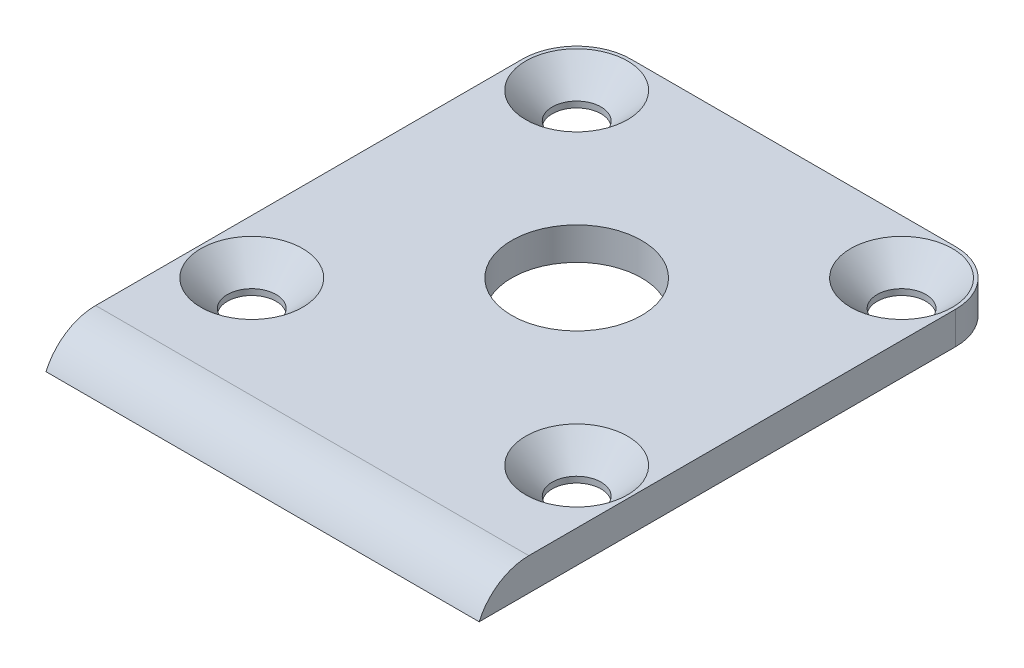
from build123d import *

# Parameters (mm, degrees)
SKETCH1_W                                      = 40
SKETCH1_H                                      = 49
SKETCH1_W_2                                    = 30
SKETCH1_H_2                                    = 30
BOSS_EXTRUDE1_DEPTH                            = 3
FILLET1_R                                      = 5
CSK_FOR_M4_FLAT_HEAD_MACHINE_SCREW2_AT_2_COUNT = 2
CSK_FOR_M4_FLAT_HEAD_MACHINE_SCREW2_AT_2_PITCH = 30
CSK_FOR_M4_FLAT_HEAD_MACHINE_SCREW2_AT_3_COUNT = 2
CSK_FOR_M4_FLAT_HEAD_MACHINE_SCREW2_AT_3_PITCH = 42.426406871
CSK_FOR_M4_FLAT_HEAD_MACHINE_SCREW2_AT_4_COUNT = 2
CSK_FOR_M4_FLAT_HEAD_MACHINE_SCREW2_AT_4_PITCH = 30
SKETCH4_R                                      = 6
CUT_EXTRUDE1_DEPTH                             = 3


with BuildPart() as part:
    # Sketch1 → Boss-Extrude1 (new body)
    # profile 1 of 2: a face of its own
    with BuildSketch(Plane(origin=(0, 0, 0), x_dir=(1, 0, 0), z_dir=(0, 1, 0))):
        with Locations((20, 24.5)):
            Rectangle(SKETCH1_W, SKETCH1_H)
        with Locations((20, 29)):
            Rectangle(SKETCH1_W_2, SKETCH1_H_2, mode=Mode.SUBTRACT)
    # profile 2 of 2: a face of its own
    with BuildSketch(Plane(origin=(0, 0, 0), x_dir=(1, 0, 0), z_dir=(0, 1, 0))):
        with Locations((20, 29)):
            Rectangle(SKETCH1_W_2, SKETCH1_H_2)
    extrude(amount=BOSS_EXTRUDE1_DEPTH)

    # Fillet1
    # the kernel refuses this fillet: 5 mm, written as the material it takes off along each edge
    with BuildSketch(Plane(origin=(-11.456439237, 3, 0), x_dir=(0, -1, 0), z_dir=(1, 0, 0))) as fillet1_piece_1:
        with BuildLine():
            CenterArc((5, 4.582575695), FILLET1_R, 180, 66.421821522)
            Line((0, 4.582575695), (-0.1, 4.582575695))
            Line((-0.1, 4.582575695), (-0.1, 0))
            Line((-0.1, 0), (0, -0.1))
            ThreePointArc((0, -0.1), (1.5, -0.1), (2.96, -0.091651514))
            Line((2.96, -0.091651514), (3, 0))
        make_face()
    extrude(amount=62.912878475, mode=Mode.SUBTRACT)
    with BuildSketch(Plane(origin=(0, -12.5, -49), x_dir=(0, 0, 1), z_dir=(0, 1, 0))) as fillet1_piece_2:
        with BuildLine():
            CenterArc((FILLET1_R, FILLET1_R), FILLET1_R, 180, 90)
            Line((0, FILLET1_R), (-FILLET1_R * 0.02, FILLET1_R))
            Line((-FILLET1_R * 0.02, FILLET1_R), (-FILLET1_R * 0.02, -FILLET1_R * 0.02))
            Line((-FILLET1_R * 0.02, -FILLET1_R * 0.02), (FILLET1_R, -FILLET1_R * 0.02))
            Line((FILLET1_R, -FILLET1_R * 0.02), (FILLET1_R, 0))
        make_face()
    extrude(amount=28, mode=Mode.SUBTRACT)
    with BuildSketch(Plane(origin=(40, -12.5, -49), x_dir=(0, 0, 1), z_dir=(0, 1, 0))) as fillet1_piece_3:
        with BuildLine():
            CenterArc((FILLET1_R, -FILLET1_R), FILLET1_R, 90, 90)
            Line((0, -FILLET1_R), (-FILLET1_R * 0.02, -FILLET1_R))
            Line((-FILLET1_R * 0.02, -FILLET1_R), (-FILLET1_R * 0.02, FILLET1_R * 0.02))
            Line((-FILLET1_R * 0.02, FILLET1_R * 0.02), (FILLET1_R, FILLET1_R * 0.02))
            Line((FILLET1_R, FILLET1_R * 0.02), (FILLET1_R, 0))
        make_face()
    extrude(amount=28, mode=Mode.SUBTRACT)

    # Sketch3 → CSK for M4 Flat Head Machine Screw2 (revolve, cut)
    with BuildSketch(Plane(origin=(5, 3, -44), x_dir=(0, 0, 1), z_dir=(1, 0, 0))):
        Polygon((0, 0), (0, 3), (2.25, 3), (2.25, 2.45), (4.7, 0), align=None)
    csk_for_m4_flat_head_machine_screw2 = revolve(axis=Axis((5, 9.35, -44), (0, -1, 0)), mode=Mode.SUBTRACT)

    # CSK for M4 Flat Head Machine Screw2 at 2: CSK for M4 Flat Head Machine Screw2 ×2
    with Locations(*[(i * CSK_FOR_M4_FLAT_HEAD_MACHINE_SCREW2_AT_2_PITCH, 0, 0) for i in range(1, CSK_FOR_M4_FLAT_HEAD_MACHINE_SCREW2_AT_2_COUNT)]):
        add(csk_for_m4_flat_head_machine_screw2, mode=Mode.SUBTRACT)

    # CSK for M4 Flat Head Machine Screw2 at 3: CSK for M4 Flat Head Machine Screw2 ×2
    with Locations(*[Vector(0.7071067811865474, 0, 0.7071067811865477) * (i * CSK_FOR_M4_FLAT_HEAD_MACHINE_SCREW2_AT_3_PITCH) for i in range(1, CSK_FOR_M4_FLAT_HEAD_MACHINE_SCREW2_AT_3_COUNT)]):
        add(csk_for_m4_flat_head_machine_screw2, mode=Mode.SUBTRACT)

    # CSK for M4 Flat Head Machine Screw2 at 4: CSK for M4 Flat Head Machine Screw2 ×2
    with Locations(*[(0, 0, i * CSK_FOR_M4_FLAT_HEAD_MACHINE_SCREW2_AT_4_PITCH) for i in range(1, CSK_FOR_M4_FLAT_HEAD_MACHINE_SCREW2_AT_4_COUNT)]):
        add(csk_for_m4_flat_head_machine_screw2, mode=Mode.SUBTRACT)

    # Sketch4 → Cut-Extrude1 (cut)
    with BuildSketch(Plane(origin=(0, 3, 0), x_dir=(1, 0, 0), z_dir=(0, 1, 0))):
        with Locations(Location((20, 29, 0), (0, 0, 270))):
            Circle(SKETCH4_R)
    extrude(amount=-CUT_EXTRUDE1_DEPTH, mode=Mode.SUBTRACT)


solid = part.part
